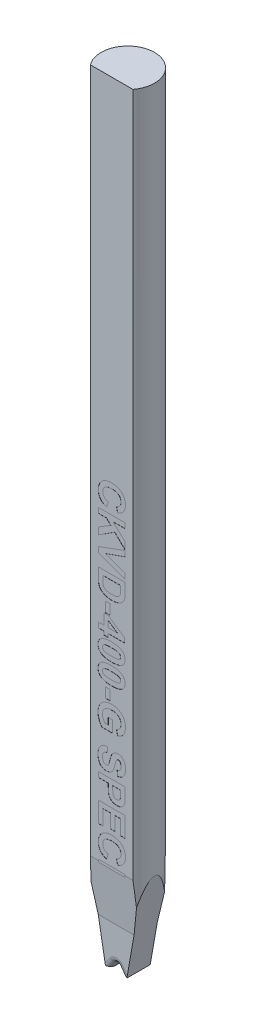
from build123d import *

# Parameters (mm, degrees)
SKETCH_TL_CUTTING_R       = 0.99695
TL_CUTTING_DEPTH          = 29.0068
SKETCH_TDF_GRINDING_W     = 2.0139
SKETCH_TDF_GRINDING_H     = 2.0139
TDF_GRINDING_DEPTH        = 30.041044486
SKETCH_ENGRAVING_W        = 0.166666667
SKETCH_ENGRAVING_H        = 0.371794872
SKETCH_ENGRAVING_W_2      = 1
SKETCH_ENGRAVING_H_2      = 0.192307693
ENGRAVING_DEPTH           = 0.005
VW_VR_GRINDING_DEPTH      = 1.00695
VW_VR_GRINDING_DEPTH_BACK = 1.00695
ISA_GRINDING_DEPTH        = 1.00695
ISA_GRINDING_DEPTH_BACK   = 1.00695
PRE_FRX_BRX_DEPTH         = 1.00695
PRE_FRX_BRX_DEPTH_BACK    = 1.00695
SKETCH_PRE_FRX_BRX_W      = 0.57134
SKETCH_PRE_FRX_BRX_H      = 1.524
FR_EDM_R                  = 0.20066
BR_EDM_R                  = 0.20066
FA_BA_GRINDING_DEPTH      = 1.00695
FA_BA_GRINDING_DEPTH_BACK = 1.00695


with BuildPart() as part:
    # sketch_TL_cutting → TL_cutting (new body)
    with BuildSketch(Plane(origin=(0, 0, 0), x_dir=(1, 0, 0), z_dir=(0, 1, 0))):
        Circle(SKETCH_TL_CUTTING_R)
    extrude(amount=TL_CUTTING_DEPTH)

    # sketch_TDF_grinding → TDF_grinding (cut, through all)
    with BuildSketch(Plane(origin=(0, 0, 0), x_dir=(1, 0, 0), z_dir=(0, 1, 0))):
        with Locations((0, -1.6102)):
            Rectangle(SKETCH_TDF_GRINDING_W, SKETCH_TDF_GRINDING_H)
    extrude(amount=TDF_GRINDING_DEPTH, mode=Mode.SUBTRACT)

    # sketch_engraving → engraving (cut)
    # profile 1 of 19: a face of its own
    with BuildSketch(Plane.XY.offset(0.60325)):
        with BuildLine():
            Line((-0.128205128, 15.210150256), (-0.192307692, 15.017842564))
            add(Edge.make_bspline(
                [(-0.192307692, 15.017842564), (-0.204917923, 15.021749052), (-0.229612721, 15.029399184), (-0.2649877, 15.043477804), (-0.297871332, 15.059472008), (-0.328259475, 15.077299875), (-0.356049464, 15.097035258), (-0.381471598, 15.118529244), (-0.404368127, 15.141993424), (-0.424673345, 15.167410624), (-0.442633936, 15.194503711), (-0.457816548, 15.223596053), (-0.470893242, 15.25425117), (-0.481488041, 15.286780557), (-0.489972889, 15.320968151), (-0.495577171, 15.356974413), (-0.499377062, 15.394630896), (-0.499789062, 15.420343283), (-0.5, 15.433507628)],
                knots=[0, 0, 0, 0, 1.126670901, 2.206376047, 3.246533763, 4.245677351, 5.210506282, 6.152793389, 7.083980095, 8.004497442, 8.926231833, 9.854395169, 10.801995143, 11.768203916, 12.771938831, 13.805609698, 14.87650608, 16, 16, 16, 16], degree=3))
            add(Edge.make_bspline(
                [(-0.5, 15.433507628), (-0.499663994, 15.449756309), (-0.499003061, 15.481717949), (-0.492350465, 15.528459052), (-0.481969511, 15.573000328), (-0.467601869, 15.615409613), (-0.448555271, 15.655388786), (-0.42571373, 15.693313108), (-0.398318662, 15.728749391), (-0.367249987, 15.761890716), (-0.332452821, 15.792019196), (-0.294134751, 15.818012297), (-0.253074131, 15.840550491), (-0.208709772, 15.858476594), (-0.161353037, 15.872561791), (-0.110975156, 15.882408328), (-0.057578507, 15.888574942), (-0.020984357, 15.889277083), (-0.002203526, 15.889637436)],
                knots=[0, 0, 0, 0, 1.025134988, 2.016471176, 2.973446247, 3.909197306, 4.836872559, 5.763618465, 6.698581235, 7.658772073, 8.627106982, 9.597494692, 10.576422683, 11.578339294, 12.6118974, 13.690673505, 14.814808564, 16, 16, 16, 16], degree=3))
            add(Edge.make_bspline(
                [(-0.002203526, 15.889637436), (0.017576475, 15.8892692), (0.056163648, 15.888550839), (0.112313555, 15.882502878), (0.165084042, 15.872456768), (0.214577853, 15.858880058), (0.260470573, 15.840669249), (0.303160692, 15.818813909), (0.342311169, 15.792696152), (0.377833814, 15.762771091), (0.409480853, 15.729637852), (0.437377469, 15.693933428), (0.460593243, 15.655431041), (0.479896446, 15.614607336), (0.494630503, 15.571163397), (0.505304611, 15.525216602), (0.511505561, 15.476746054), (0.512376199, 15.44360808), (0.512820513, 15.426696731)],
                knots=[0, 0, 0, 0, 1.212773307, 2.365899439, 3.458117515, 4.504331001, 5.50806732, 6.480562534, 7.440239902, 8.387651817, 9.323121479, 10.245404239, 11.160468186, 12.07454208, 13.009500751, 13.96802424, 14.963018902, 16, 16, 16, 16], degree=3))
            add(Edge.make_bspline(
                [(0.512820513, 15.426696731), (0.512448361, 15.411927276), (0.511718707, 15.382969796), (0.506761415, 15.340564506), (0.498061698, 15.300376158), (0.486319015, 15.262187521), (0.470821797, 15.226215987), (0.451884357, 15.192397111), (0.429606892, 15.160614651), (0.412205553, 15.141465065), (0.403445513, 15.131824936)],
                knots=[0, 0, 0, 0, 1.098510076, 2.153775193, 3.169777012, 4.153122333, 5.120892526, 6.076995459, 7.031936742, 8, 8, 8, 8], degree=3))
            add(Edge.make_bspline(
                [(0.403445513, 15.131824936), (0.39787141, 15.126237644), (0.386592274, 15.114931818), (0.367549896, 15.099835368), (0.347050772, 15.085522058), (0.324745215, 15.072219068), (0.30046466, 15.060346849), (0.274581981, 15.049334097), (0.246997406, 15.039195069), (0.227800247, 15.033556604), (0.217948718, 15.030663077)],
                knots=[0, 0, 0, 0, 0.885292881, 1.791380647, 2.722937556, 3.69093542, 4.703306561, 5.754477758, 6.847650944, 8, 8, 8, 8], degree=3))
            Line((0.217948718, 15.030663077), (0.179487179, 15.222970769))
            add(Edge.make_bspline(
                [(0.179487179, 15.222970769), (0.1857949, 15.224605288), (0.198219456, 15.227824861), (0.21607256, 15.23433955), (0.233014714, 15.241811208), (0.248625569, 15.2510761), (0.263619506, 15.260902074), (0.277222328, 15.272564773), (0.290109132, 15.285069754), (0.301694454, 15.298958861), (0.312145605, 15.313833589), (0.321339918, 15.329543983), (0.329014435, 15.346128478), (0.335156827, 15.363461754), (0.340319842, 15.381485702), (0.34350638, 15.400372147), (0.345953545, 15.419955752), (0.3460861, 15.433298875), (0.346153846, 15.440118205)],
                knots=[0, 0, 0, 0, 1.051114734, 2.070420253, 3.064047898, 4.034553068, 4.997066449, 5.953344811, 6.921213386, 7.892675544, 8.867420182, 9.852654213, 10.826683617, 11.811917648, 12.818610352, 13.848120519, 14.900229319, 16, 16, 16, 16], degree=3))
            add(Edge.make_bspline(
                [(0.346153846, 15.440118205), (0.345958725, 15.449482256), (0.345576529, 15.46782423), (0.341532101, 15.49455448), (0.335695112, 15.519995692), (0.326982094, 15.54405706), (0.315677399, 15.566671698), (0.302244603, 15.588168905), (0.286035184, 15.608000806), (0.26758257, 15.626639764), (0.246135655, 15.643347721), (0.221779967, 15.658050652), (0.194212535, 15.670244121), (0.163711493, 15.680144409), (0.130202077, 15.687936736), (0.093641969, 15.693501162), (0.054005962, 15.696578434), (0.026581025, 15.697073903), (0.012419872, 15.697329744)],
                knots=[0, 0, 0, 0, 0.93816214, 1.837638998, 2.704791736, 3.551915875, 4.396257554, 5.235807848, 6.087970119, 6.959042444, 7.860386085, 8.80649345, 9.804409709, 10.875695391, 12.017327537, 13.250155505, 14.580089023, 16, 16, 16, 16], degree=3))
            add(Edge.make_bspline(
                [(0.012419872, 15.697329744), (-0.002609028, 15.697076423), (-0.031567402, 15.696588312), (-0.073337178, 15.693511685), (-0.111754322, 15.687911705), (-0.14688701, 15.680222849), (-0.178713725, 15.670272973), (-0.207179389, 15.658099106), (-0.23231734, 15.643626701), (-0.254110839, 15.626878275), (-0.272831387, 15.608277256), (-0.288926796, 15.588327439), (-0.302688307, 15.567146524), (-0.314010391, 15.544607053), (-0.322575422, 15.520623298), (-0.328786932, 15.495392371), (-0.332735688, 15.468821695), (-0.333131326, 15.450615799), (-0.333333333, 15.441320128)],
                knots=[0, 0, 0, 0, 1.475208372, 2.842499301, 4.107722225, 5.282836115, 6.369007568, 7.375918121, 8.315702116, 9.208439171, 10.065831443, 10.90006451, 11.71996243, 12.54067204, 13.369972975, 14.214060185, 15.088124569, 16, 16, 16, 16], degree=3))
            add(Edge.make_bspline(
                [(-0.333333333, 15.441320128), (-0.333161634, 15.434437953), (-0.332824013, 15.420905176), (-0.330681155, 15.400902689), (-0.326591822, 15.38170438), (-0.321184418, 15.363216281), (-0.314399721, 15.345366559), (-0.305696319, 15.32842748), (-0.295693052, 15.312065777), (-0.283969989, 15.29662094), (-0.270808612, 15.281886156), (-0.255597341, 15.268447159), (-0.238701667, 15.255981373), (-0.220008678, 15.244646947), (-0.199678377, 15.23406516), (-0.177394008, 15.225062121), (-0.153515697, 15.216674984), (-0.136789345, 15.212363153), (-0.128205128, 15.210150256)],
                knots=[0, 0, 0, 0, 0.980177776, 1.927374078, 2.859849964, 3.771585772, 4.668674471, 5.574490016, 6.479656464, 7.396337719, 8.332153134, 9.288470092, 10.28125149, 11.318486971, 12.398724812, 13.541284404, 14.738150009, 16, 16, 16, 16], degree=3))
        make_face()
    # profile 2 of 19: a face of its own
    with BuildSketch(Plane.XY.offset(0.60325)):
        Polygon((-0.5, 14.851175897), (0.5, 14.851175897), (0.5, 14.658868205), (0.052283654, 14.658868205), (0.5, 14.237193526), (0.5, 13.972970769), (0.11338141, 14.352778462), (-0.5, 13.960150256), (-0.5, 14.216360192), (-0.035456731, 14.498611795), (-0.198517628, 14.658868205), (-0.5, 14.658868205), align=None)
    # profile 3 of 19: a face of its own
    with BuildSketch(Plane.XY.offset(0.60325)):
        Polygon((-0.5, 13.583948333), (0.5, 13.95374), (0.5, 13.750615), (-0.243589744, 13.485791282), (0.5, 13.221969167), (0.5, 13.017842564), (-0.5, 13.386231987), align=None)
    # profile 4 of 19: a face of its own
    with BuildSketch(Plane.XY.offset(0.60325)):
        with BuildLine():
            Line((0.5, 12.928098974), (0.5, 12.561312115))
            add(Edge.make_bspline(
                [(0.5, 12.561312115), (0.500005193, 12.551294571), (0.500015306, 12.531788084), (0.498840892, 12.503479066), (0.497659587, 12.477006494), (0.495294873, 12.452446352), (0.492816233, 12.429713432), (0.489678088, 12.408766942), (0.485656212, 12.389739202), (0.482484481, 12.377740319), (0.480969551, 12.372009231)],
                knots=[0, 0, 0, 0, 1.259756885, 2.453039283, 3.563158368, 4.591894114, 5.55549294, 6.43918076, 7.254497783, 8, 8, 8, 8], degree=3))
            add(Edge.make_bspline(
                [(0.480969551, 12.372009231), (0.478637325, 12.364840254), (0.474014881, 12.350631431), (0.465827813, 12.329778378), (0.455960096, 12.309944479), (0.445111978, 12.290669819), (0.432903728, 12.272397553), (0.419595761, 12.254682873), (0.404753223, 12.238049803), (0.383633179, 12.21651514), (0.35420815, 12.192090255), (0.315375005, 12.16625972), (0.272594656, 12.144522014), (0.234409605, 12.129330641), (0.20183843, 12.119286542), (0.175754603, 12.112718141), (0.148301213, 12.107046468), (0.119383738, 12.102796292), (0.08913491, 12.099134906), (0.057465542, 12.096507238), (0.024383276, 12.09520625), (0.001870575, 12.094914494), (-0.009615385, 12.094765641)],
                knots=[0, 0, 0, 0, 0.745431882, 1.477436776, 2.212739876, 2.934276521, 3.663147754, 4.384200836, 5.123377481, 5.865761747, 7.365547505, 8.894711587, 10.468722596, 12.101948761, 12.951987285, 13.837595333, 14.760899389, 15.722756883, 16.726861385, 17.773652936, 18.864119771, 20, 20, 20, 20], degree=3))
            add(Edge.make_bspline(
                [(-0.009615385, 12.094765641), (-0.0294616, 12.095157046), (-0.067834928, 12.09591384), (-0.123301552, 12.101511211), (-0.17465514, 12.110806648), (-0.206804138, 12.120517075), (-0.222355769, 12.125214359)],
                knots=[0, 0, 0, 0, 1.103491527, 2.133638164, 3.0971734, 4, 4, 4, 4], degree=3))
            add(Edge.make_bspline(
                [(-0.222355769, 12.125214359), (-0.231274521, 12.128388003), (-0.248819098, 12.134631057), (-0.274127236, 12.145555932), (-0.298211673, 12.157360337), (-0.321053432, 12.170142184), (-0.342549771, 12.183966052), (-0.362636394, 12.198883645), (-0.381577746, 12.214663731), (-0.393236239, 12.22609549), (-0.399038462, 12.231784872)],
                knots=[0, 0, 0, 0, 1.090884612, 2.145940218, 3.175104604, 4.181306866, 5.161203701, 6.118658341, 7.063689906, 8, 8, 8, 8], degree=3))
            add(Edge.make_bspline(
                [(-0.399038462, 12.231784872), (-0.407300305, 12.241071145), (-0.424264154, 12.260138431), (-0.445652736, 12.29348995), (-0.464086504, 12.331365276), (-0.473760833, 12.358679168), (-0.478766026, 12.372810513)],
                knots=[0, 0, 0, 0, 0.912008655, 1.872605891, 2.89935344, 4, 4, 4, 4], degree=3))
            add(Edge.make_bspline(
                [(-0.478766026, 12.372810513), (-0.4805228, 12.378530486), (-0.484168894, 12.390401996), (-0.488062998, 12.409225444), (-0.492165475, 12.429319947), (-0.49463687, 12.450917223), (-0.497243066, 12.473793081), (-0.498706299, 12.498129822), (-0.49974511, 12.523843081), (-0.499913777, 12.541479175), (-0.5, 12.550494808)],
                knots=[0, 0, 0, 0, 0.799129865, 1.658552685, 2.566799617, 3.538529252, 4.561352959, 5.643373779, 6.795284424, 8, 8, 8, 8], degree=3))
            Line((-0.5, 12.550494808), (-0.5, 12.928098974))
            Line((-0.5, 12.928098974), (0.5, 12.928098974))
        make_face()
        with BuildLine():
            Line((0.333333333, 12.735791282), (-0.333333333, 12.735791282))
            Line((-0.333333333, 12.735791282), (-0.333333333, 12.577538077))
            add(Edge.make_bspline(
                [(-0.333333333, 12.577538077), (-0.333276671, 12.57039336), (-0.333167574, 12.556637049), (-0.332847006, 12.536731316), (-0.331979167, 12.518438115), (-0.331080228, 12.501661614), (-0.329595022, 12.48644549), (-0.328134266, 12.472723535), (-0.326090699, 12.460572132), (-0.324477534, 12.453067127), (-0.323717949, 12.449533269)],
                knots=[0, 0, 0, 0, 1.333384787, 2.567275092, 3.714769766, 4.750907381, 5.701951617, 6.567520054, 7.325492842, 8, 8, 8, 8], degree=3))
            add(Edge.make_bspline(
                [(-0.323717949, 12.449533269), (-0.321509316, 12.441256575), (-0.317207482, 12.425135757), (-0.307617456, 12.402500499), (-0.296048139, 12.382018507), (-0.282136533, 12.36334677), (-0.26455548, 12.34651967), (-0.242070693, 12.332155683), (-0.215254411, 12.318862192), (-0.189584523, 12.309758806), (-0.16665678, 12.303224413), (-0.147412959, 12.298801165), (-0.126593091, 12.295305591), (-0.104279343, 12.292298942), (-0.080500412, 12.289869499), (-0.055170426, 12.288357784), (-0.028320392, 12.287326029), (-0.009883527, 12.287159161), (-0.000400641, 12.287073333)],
                knots=[0, 0, 0, 0, 1.038686998, 2.023088296, 2.974059649, 3.888265163, 4.839857954, 5.909819677, 7.113156087, 8.466843969, 9.20827164, 10.006482943, 10.861893492, 11.769681931, 12.739021491, 13.762258324, 14.849031541, 16, 16, 16, 16], degree=3))
            add(Edge.make_bspline(
                [(-0.000400641, 12.287073333), (0.009082275, 12.2871585), (0.027452469, 12.287323485), (0.054102292, 12.288353664), (0.079033415, 12.289856863), (0.102276578, 12.292303691), (0.123864169, 12.295263456), (0.143813574, 12.298800891), (0.161996804, 12.303194423), (0.183589283, 12.309747511), (0.207947697, 12.319584996), (0.23429421, 12.333411199), (0.2571147, 12.349676402), (0.276689574, 12.368031558), (0.29287817, 12.389118569), (0.306422028, 12.412489371), (0.316938162, 12.438620279), (0.321416742, 12.457209318), (0.323717949, 12.466760833)],
                knots=[0, 0, 0, 0, 1.118059345, 2.165891593, 3.144157881, 4.062285166, 4.920717571, 5.712910489, 6.449981617, 7.12489426, 8.371943983, 9.541298068, 10.624898781, 11.666293176, 12.69306237, 13.747704633, 14.842713931, 16, 16, 16, 16], degree=3))
            add(Edge.make_bspline(
                [(0.323717949, 12.466760833), (0.324486218, 12.470895143), (0.326177652, 12.479997311), (0.328151987, 12.495101571), (0.329628909, 12.512888179), (0.331099472, 12.533317116), (0.331977905, 12.556367064), (0.332859431, 12.582072571), (0.333166326, 12.610456851), (0.333276065, 12.630289207), (0.333333333, 12.640639038)],
                knots=[0, 0, 0, 0, 0.578739524, 1.274162912, 2.095457587, 3.035141998, 4.093102578, 5.270121571, 6.575369351, 8, 8, 8, 8], degree=3))
            Line((0.333333333, 12.640639038), (0.333333333, 12.735791282))
        make_face(mode=Mode.SUBTRACT)
    # profile 5 of 19: a face of its own
    with BuildSketch(Plane.XY.offset(0.60325)):
        with Locations((-0.147435898, 11.767842564)):
            Rectangle(SKETCH_ENGRAVING_W, SKETCH_ENGRAVING_H)
    # profile 6 of 19: a face of its own
    with BuildSketch(Plane.XY.offset(0.60325)):
        Polygon((-0.5, 11.146047692), (-0.294871795, 11.146047692), (-0.294871795, 11.54348359), (-0.12880609, 11.54348359), (0.487179487, 11.120606987), (0.487179487, 10.95374), (-0.128205128, 10.95374), (-0.128205128, 10.825534872), (-0.294871795, 10.825534872), (-0.294871795, 10.95374), (-0.5, 10.95374), align=None)
        Polygon((-0.128205128, 11.146047692), (0.204727564, 11.146047692), (-0.128205128, 11.374813718), align=None, mode=Mode.SUBTRACT)
    # profile 7 of 19: a face of its own
    with BuildSketch(Plane.XY.offset(0.60325)):
        with BuildLine():
            add(Edge.make_bspline(
                [(0.5, 10.421688718), (0.49971384, 10.409784998), (0.499156721, 10.386609821), (0.494192381, 10.352847508), (0.486315205, 10.321094925), (0.474936732, 10.291345943), (0.460535804, 10.263449267), (0.442472771, 10.237797415), (0.421624591, 10.21379643), (0.405435577, 10.199940797), (0.397235577, 10.192922692)],
                knots=[0, 0, 0, 0, 1.098626248, 2.138899374, 3.143835643, 4.113754749, 5.073488057, 6.034745239, 7.004566348, 8, 8, 8, 8], degree=3))
            add(Edge.make_bspline(
                [(0.397235577, 10.192922692), (0.392013767, 10.188907993), (0.381356969, 10.180714695), (0.364136726, 10.16968029), (0.345869985, 10.159071685), (0.326116385, 10.149813442), (0.305221356, 10.140940078), (0.283126793, 10.132749313), (0.259707844, 10.12551695), (0.235071142, 10.119212124), (0.209179241, 10.113318627), (0.181968999, 10.108381398), (0.15350924, 10.104155972), (0.123831018, 10.100860738), (0.092992495, 10.097906339), (0.060842825, 10.096289757), (0.027454838, 10.094965267), (0.004742429, 10.094832949), (-0.006810897, 10.094765641)],
                knots=[0, 0, 0, 0, 0.746775751, 1.524038446, 2.317840886, 3.141016509, 3.996283186, 4.892488336, 5.812382473, 6.774967264, 7.776368117, 8.823659909, 9.910833035, 11.039122168, 12.210293276, 13.424012874, 14.68964937, 16, 16, 16, 16], degree=3))
            add(Edge.make_bspline(
                [(-0.006810897, 10.094765641), (-0.01836425, 10.094831934), (-0.041009977, 10.094961876), (-0.074330982, 10.096294693), (-0.106413621, 10.097907781), (-0.13725379, 10.100853853), (-0.166926114, 10.104180728), (-0.195353975, 10.108286272), (-0.22243919, 10.113604764), (-0.248289812, 10.119411418), (-0.27303117, 10.125676077), (-0.296407841, 10.1332299), (-0.318777777, 10.141090303), (-0.339699687, 10.150169898), (-0.359477735, 10.159760372), (-0.377930928, 10.170211112), (-0.395257891, 10.181368726), (-0.40597091, 10.189641289), (-0.411258013, 10.193723974)],
                knots=[0, 0, 0, 0, 1.308411734, 2.564617834, 3.776541518, 4.94597967, 6.0725993, 7.15816376, 8.197872509, 9.197791611, 10.158952087, 11.086962723, 11.979249638, 12.843171697, 13.668427753, 14.467630577, 15.243743175, 16, 16, 16, 16], degree=3))
            add(Edge.make_bspline(
                [(-0.411258013, 10.193723974), (-0.419387722, 10.200677875), (-0.435436162, 10.214405209), (-0.456111536, 10.238140465), (-0.473801555, 10.2637509), (-0.487914093, 10.291597064), (-0.499368982, 10.321201236), (-0.506993451, 10.353005546), (-0.511967929, 10.386675616), (-0.512532265, 10.409851213), (-0.512820513, 10.421688718)],
                knots=[0, 0, 0, 0, 0.991667276, 1.957599061, 2.911530233, 3.873218945, 4.847995157, 5.850445929, 6.902062539, 8, 8, 8, 8], degree=3))
            add(Edge.make_bspline(
                [(-0.512820513, 10.421688718), (-0.512476011, 10.433661133), (-0.511800941, 10.457121702), (-0.506449472, 10.491375149), (-0.497876451, 10.523934622), (-0.485636462, 10.554683234), (-0.469774335, 10.583576989), (-0.45076002, 10.610841616), (-0.427732542, 10.635883948), (-0.40629523, 10.655489361), (-0.386925042, 10.669832741), (-0.37086259, 10.679949036), (-0.353675124, 10.689725358), (-0.33482528, 10.698163499), (-0.314870578, 10.706488475), (-0.293380967, 10.713861787), (-0.270541238, 10.720366959), (-0.246455682, 10.726474901), (-0.220958398, 10.731568025), (-0.194124629, 10.736252952), (-0.165840258, 10.739944927), (-0.136262825, 10.743218243), (-0.105322509, 10.745522844), (-0.073069943, 10.747394475), (-0.039401887, 10.748332969), (-0.01649349, 10.748517608), (-0.004807692, 10.748611795)],
                knots=[0, 0, 0, 0, 1.257818097, 2.464759732, 3.634271214, 4.790227596, 5.933394726, 7.09190477, 8.274482889, 9.50191983, 10.139172818, 10.805000628, 11.49619854, 12.215266328, 12.973768034, 13.768328009, 14.601232062, 15.469317089, 16.379095881, 17.333267023, 18.331755967, 19.376479622, 20.460535752, 21.592206075, 22.771760786, 24, 24, 24, 24], degree=3))
            add(Edge.make_bspline(
                [(-0.004807692, 10.748611795), (0.006678925, 10.748546), (0.02919122, 10.748417052), (0.062378132, 10.747074948), (0.094328674, 10.745481634), (0.12509981, 10.74250902), (0.154640959, 10.739209515), (0.183004063, 10.735096894), (0.209982531, 10.729678814), (0.235876189, 10.724329743), (0.260431507, 10.717589782), (0.2837906, 10.710164475), (0.306110518, 10.702330136), (0.326924245, 10.693157854), (0.346659803, 10.683622898), (0.365109758, 10.673164838), (0.382437536, 10.662009066), (0.39315045, 10.653736265), (0.3984375, 10.649653462)],
                knots=[0, 0, 0, 0, 1.304443357, 2.556541329, 3.771813033, 4.936929721, 6.066661712, 7.147723817, 8.190304831, 9.191350322, 10.149780912, 11.080355239, 11.975107155, 12.834450748, 13.66198663, 14.463397305, 15.241653965, 16, 16, 16, 16], degree=3))
            add(Edge.make_bspline(
                [(0.3984375, 10.649653462), (0.406566428, 10.642699179), (0.422613323, 10.628971089), (0.443299998, 10.605241361), (0.460913987, 10.579659209), (0.475197493, 10.551894301), (0.486497465, 10.522222107), (0.494183265, 10.490376121), (0.499144648, 10.456700686), (0.499710816, 10.433525839), (0.5, 10.421688718)],
                knots=[0, 0, 0, 0, 0.991631672, 1.957528776, 2.911425699, 3.867574088, 4.848108326, 5.850523106, 6.902101959, 8, 8, 8, 8], degree=3))
        make_face()
        with BuildLine():
            add(Edge.make_bspline(
                [(0.333333333, 10.421688718), (0.333068079, 10.427856684), (0.332548986, 10.439927158), (0.328316127, 10.457482094), (0.321759633, 10.474063165), (0.312130705, 10.489621206), (0.299093083, 10.50402978), (0.281476094, 10.516237658), (0.259881539, 10.526791162), (0.243736, 10.532070771), (0.235176282, 10.534869808)],
                knots=[0, 0, 0, 0, 0.909107913, 1.77908945, 2.650019014, 3.530482969, 4.465025013, 5.495890128, 6.672421267, 8, 8, 8, 8], degree=3))
            add(Edge.make_bspline(
                [(0.235176282, 10.534869808), (0.228718042, 10.536617997), (0.214837576, 10.540375317), (0.192206647, 10.54463972), (0.166522939, 10.548156485), (0.137792419, 10.551126038), (0.105999886, 10.553542628), (0.071125109, 10.555030848), (0.033192525, 10.556059478), (0.006878451, 10.556220391), (-0.006810897, 10.556304103)],
                knots=[0, 0, 0, 0, 0.658986521, 1.416336438, 2.266694271, 3.212608458, 4.261595115, 5.407496572, 6.651304179, 8, 8, 8, 8], degree=3))
            add(Edge.make_bspline(
                [(-0.006810897, 10.556304103), (-0.020433943, 10.556313117), (-0.046549094, 10.556330397), (-0.084006477, 10.555156163), (-0.118154033, 10.55398872), (-0.148991056, 10.551619061), (-0.176626244, 10.549280892), (-0.200847568, 10.545743343), (-0.221857789, 10.542190608), (-0.244486895, 10.536157153), (-0.268257705, 10.527841394), (-0.292448985, 10.516612977), (-0.311537375, 10.503947058), (-0.325415776, 10.489415587), (-0.334597404, 10.473670329), (-0.341538269, 10.457366395), (-0.345246665, 10.439814555), (-0.345848983, 10.427780013), (-0.346153846, 10.421688718)],
                knots=[0, 0, 0, 0, 1.613038927, 3.092168624, 4.43749063, 5.658264602, 6.75425577, 7.720394221, 8.556328411, 9.275513998, 10.490872946, 11.534172084, 12.42681833, 13.187531851, 13.88996177, 14.574222125, 15.278341114, 16, 16, 16, 16], degree=3))
            add(Edge.make_bspline(
                [(-0.346153846, 10.421688718), (-0.345874419, 10.41559088), (-0.345321688, 10.403528799), (-0.341225408, 10.385996833), (-0.334465655, 10.369439336), (-0.325029126, 10.353776493), (-0.311901617, 10.33935441), (-0.294300445, 10.327137614), (-0.272700888, 10.31658693), (-0.25655611, 10.311306893), (-0.247996795, 10.308507628)],
                knots=[0, 0, 0, 0, 0.899391665, 1.779078861, 2.640979247, 3.529945348, 4.464599804, 5.495588918, 6.672261578, 8, 8, 8, 8], degree=3))
            add(Edge.make_bspline(
                [(-0.247996795, 10.308507628), (-0.241538043, 10.306761968), (-0.227719754, 10.303027186), (-0.205229709, 10.298732396), (-0.179679092, 10.29520611), (-0.151079269, 10.292264791), (-0.11935541, 10.289824431), (-0.084546407, 10.288348845), (-0.046680798, 10.287319247), (-0.020433482, 10.287157356), (-0.006810897, 10.287073333)],
                knots=[0, 0, 0, 0, 0.66114423, 1.414496391, 2.261103113, 3.210114492, 4.255954433, 5.405607896, 6.653488082, 8, 8, 8, 8], degree=3))
            add(Edge.make_bspline(
                [(-0.006810897, 10.287073333), (0.006810741, 10.287187109), (0.032921137, 10.287405199), (0.070464093, 10.288032091), (0.104645163, 10.289787006), (0.13553417, 10.291543226), (0.163028833, 10.294508631), (0.187277888, 10.297451537), (0.208178651, 10.301523667), (0.23096624, 10.307115697), (0.254848985, 10.31545368), (0.278913284, 10.32702584), (0.298191428, 10.33946291), (0.312146257, 10.353969879), (0.321683592, 10.369688044), (0.328364426, 10.386140374), (0.332523972, 10.403589531), (0.333060584, 10.41558941), (0.333333333, 10.421688718)],
                knots=[0, 0, 0, 0, 1.611458614, 3.088895909, 4.441089836, 5.660086535, 6.747875232, 7.711965119, 8.548505902, 9.26500436, 10.486583113, 11.532259092, 12.419544583, 13.184925779, 13.890764661, 14.581638641, 15.279074115, 16, 16, 16, 16], degree=3))
        make_face(mode=Mode.SUBTRACT)
    # profile 8 of 19: a face of its own
    with BuildSketch(Plane.XY.offset(0.60325)):
        with BuildLine():
            add(Edge.make_bspline(
                [(0.5, 9.652457949), (0.49971384, 9.640554229), (0.499156721, 9.617379051), (0.494192381, 9.583616739), (0.486315205, 9.551864156), (0.474936732, 9.522115173), (0.460535804, 9.494218497), (0.442472771, 9.468566646), (0.421624591, 9.444565661), (0.405435577, 9.430710028), (0.397235577, 9.423691923)],
                knots=[0, 0, 0, 0, 1.098626248, 2.138899374, 3.143835643, 4.113754749, 5.073488057, 6.034745239, 7.004566348, 8, 8, 8, 8], degree=3))
            add(Edge.make_bspline(
                [(0.397235577, 9.423691923), (0.392013767, 9.419677224), (0.381356969, 9.411483926), (0.364136726, 9.40044952), (0.345869985, 9.389840915), (0.326116385, 9.380582673), (0.305221356, 9.371709309), (0.283126793, 9.363518544), (0.259707844, 9.35628618), (0.235071142, 9.349981354), (0.209179241, 9.344087858), (0.181968999, 9.339150628), (0.15350924, 9.334925203), (0.123831018, 9.331629969), (0.092992495, 9.32867557), (0.060842825, 9.327058988), (0.027454838, 9.325734498), (0.004742429, 9.325602179), (-0.006810897, 9.325534872)],
                knots=[0, 0, 0, 0, 0.746775751, 1.524038446, 2.317840886, 3.141016509, 3.996283186, 4.892488336, 5.812382473, 6.774967264, 7.776368117, 8.823659909, 9.910833035, 11.039122168, 12.210293276, 13.424012874, 14.68964937, 16, 16, 16, 16], degree=3))
            add(Edge.make_bspline(
                [(-0.006810897, 9.325534872), (-0.01836425, 9.325601165), (-0.041009977, 9.325731107), (-0.074330982, 9.327063924), (-0.106413621, 9.328677012), (-0.13725379, 9.331623084), (-0.166926114, 9.334949959), (-0.195353975, 9.339055503), (-0.22243919, 9.344373995), (-0.248289812, 9.350180649), (-0.27303117, 9.356445308), (-0.296407841, 9.363999131), (-0.318777777, 9.371859533), (-0.339699687, 9.380939129), (-0.359477735, 9.390529602), (-0.377930928, 9.400980342), (-0.395257891, 9.412137957), (-0.40597091, 9.42041052), (-0.411258013, 9.424493205)],
                knots=[0, 0, 0, 0, 1.308411734, 2.564617834, 3.776541518, 4.94597967, 6.0725993, 7.15816376, 8.197872509, 9.197791611, 10.158952087, 11.086962723, 11.979249638, 12.843171697, 13.668427753, 14.467630577, 15.243743175, 16, 16, 16, 16], degree=3))
            add(Edge.make_bspline(
                [(-0.411258013, 9.424493205), (-0.419387722, 9.431447105), (-0.435436162, 9.44517444), (-0.456111536, 9.468909695), (-0.473801555, 9.494520131), (-0.487914093, 9.522366295), (-0.499368982, 9.551970467), (-0.506993451, 9.583774777), (-0.511967929, 9.617444847), (-0.512532265, 9.640620444), (-0.512820513, 9.652457949)],
                knots=[0, 0, 0, 0, 0.991667276, 1.957599061, 2.911530233, 3.873218945, 4.847995157, 5.850445929, 6.902062539, 8, 8, 8, 8], degree=3))
            add(Edge.make_bspline(
                [(-0.512820513, 9.652457949), (-0.512476011, 9.664430364), (-0.511800941, 9.687890933), (-0.506449472, 9.722144379), (-0.497876451, 9.754703853), (-0.485636462, 9.785452465), (-0.469774335, 9.81434622), (-0.45076002, 9.841610847), (-0.427732542, 9.866653179), (-0.40629523, 9.886258592), (-0.386925042, 9.900601971), (-0.37086259, 9.910718267), (-0.353675124, 9.920494589), (-0.33482528, 9.92893273), (-0.314870578, 9.937257706), (-0.293380967, 9.944631018), (-0.270541238, 9.95113619), (-0.246455682, 9.957244132), (-0.220958398, 9.962337256), (-0.194124629, 9.967022183), (-0.165840258, 9.970714157), (-0.136262825, 9.973987473), (-0.105322509, 9.976292075), (-0.073069943, 9.978163706), (-0.039401887, 9.9791022), (-0.01649349, 9.979286839), (-0.004807692, 9.979381026)],
                knots=[0, 0, 0, 0, 1.257818097, 2.464759732, 3.634271214, 4.790227596, 5.933394726, 7.09190477, 8.274482889, 9.50191983, 10.139172818, 10.805000628, 11.49619854, 12.215266328, 12.973768034, 13.768328009, 14.601232062, 15.469317089, 16.379095881, 17.333267023, 18.331755967, 19.376479622, 20.460535752, 21.592206075, 22.771760786, 24, 24, 24, 24], degree=3))
            add(Edge.make_bspline(
                [(-0.004807692, 9.979381026), (0.006678925, 9.979315231), (0.02919122, 9.979186282), (0.062378132, 9.977844179), (0.094328674, 9.976250865), (0.12509981, 9.973278251), (0.154640959, 9.969978746), (0.183004063, 9.965866125), (0.209982531, 9.960448045), (0.235876189, 9.955098974), (0.260431507, 9.948359013), (0.2837906, 9.940933706), (0.306110518, 9.933099367), (0.326924245, 9.923927084), (0.346659803, 9.914392128), (0.365109758, 9.903934069), (0.382437536, 9.892778297), (0.39315045, 9.884505495), (0.3984375, 9.880422692)],
                knots=[0, 0, 0, 0, 1.304443357, 2.556541329, 3.771813033, 4.936929721, 6.066661712, 7.147723817, 8.190304831, 9.191350322, 10.149780912, 11.080355239, 11.975107155, 12.834450748, 13.66198663, 14.463397305, 15.241653965, 16, 16, 16, 16], degree=3))
            add(Edge.make_bspline(
                [(0.3984375, 9.880422692), (0.406566428, 9.87346841), (0.422613323, 9.85974032), (0.443299998, 9.836010592), (0.460913987, 9.810428439), (0.475197493, 9.782663532), (0.486497465, 9.752991338), (0.494183265, 9.721145352), (0.499144648, 9.687469916), (0.499710816, 9.66429507), (0.5, 9.652457949)],
                knots=[0, 0, 0, 0, 0.991631672, 1.957528776, 2.911425699, 3.867574088, 4.848108326, 5.850523106, 6.902101959, 8, 8, 8, 8], degree=3))
        make_face()
        with BuildLine():
            add(Edge.make_bspline(
                [(0.333333333, 9.652457949), (0.333068079, 9.658625915), (0.332548986, 9.670696389), (0.328316127, 9.688251325), (0.321759633, 9.704832396), (0.312130705, 9.720390436), (0.299093083, 9.734799011), (0.281476094, 9.747006888), (0.259881539, 9.757560392), (0.243736, 9.762840001), (0.235176282, 9.765639038)],
                knots=[0, 0, 0, 0, 0.909107913, 1.77908945, 2.650019014, 3.530482969, 4.465025013, 5.495890128, 6.672421267, 8, 8, 8, 8], degree=3))
            add(Edge.make_bspline(
                [(0.235176282, 9.765639038), (0.228718042, 9.767387227), (0.214837576, 9.771144548), (0.192206647, 9.775408951), (0.166522939, 9.778925716), (0.137792419, 9.781895269), (0.105999886, 9.784311859), (0.071125109, 9.785800078), (0.033192525, 9.786828709), (0.006878451, 9.786989622), (-0.006810897, 9.787073333)],
                knots=[0, 0, 0, 0, 0.658986521, 1.416336438, 2.266694271, 3.212608458, 4.261595115, 5.407496572, 6.651304179, 8, 8, 8, 8], degree=3))
            add(Edge.make_bspline(
                [(-0.006810897, 9.787073333), (-0.020433943, 9.787082347), (-0.046549094, 9.787099627), (-0.084006477, 9.785925394), (-0.118154033, 9.784757951), (-0.148991056, 9.782388292), (-0.176626244, 9.780050123), (-0.200847568, 9.776512574), (-0.221857789, 9.772959839), (-0.244486895, 9.766926384), (-0.268257705, 9.758610625), (-0.292448985, 9.747382207), (-0.311537375, 9.734716289), (-0.325415776, 9.720184818), (-0.334597404, 9.70443956), (-0.341538269, 9.688135625), (-0.345246665, 9.670583786), (-0.345848983, 9.658549244), (-0.346153846, 9.652457949)],
                knots=[0, 0, 0, 0, 1.613038927, 3.092168624, 4.43749063, 5.658264602, 6.75425577, 7.720394221, 8.556328411, 9.275513998, 10.490872946, 11.534172084, 12.42681833, 13.187531851, 13.88996177, 14.574222125, 15.278341114, 16, 16, 16, 16], degree=3))
            add(Edge.make_bspline(
                [(-0.346153846, 9.652457949), (-0.345874419, 9.646360111), (-0.345321688, 9.63429803), (-0.341225408, 9.616766063), (-0.334465655, 9.600208567), (-0.325029126, 9.584545723), (-0.311901617, 9.570123641), (-0.294300445, 9.557906845), (-0.272700888, 9.547356161), (-0.25655611, 9.542076123), (-0.247996795, 9.539276859)],
                knots=[0, 0, 0, 0, 0.899391665, 1.779078861, 2.640979247, 3.529945348, 4.464599804, 5.495588918, 6.672261578, 8, 8, 8, 8], degree=3))
            add(Edge.make_bspline(
                [(-0.247996795, 9.539276859), (-0.241538043, 9.537531199), (-0.227719754, 9.533796417), (-0.205229709, 9.529501627), (-0.179679092, 9.52597534), (-0.151079269, 9.523034022), (-0.11935541, 9.520593662), (-0.084546407, 9.519118076), (-0.046680798, 9.518088478), (-0.020433482, 9.517926587), (-0.006810897, 9.517842564)],
                knots=[0, 0, 0, 0, 0.66114423, 1.414496391, 2.261103113, 3.210114492, 4.255954433, 5.405607896, 6.653488082, 8, 8, 8, 8], degree=3))
            add(Edge.make_bspline(
                [(-0.006810897, 9.517842564), (0.006810741, 9.51795634), (0.032921137, 9.51817443), (0.070464093, 9.518801322), (0.104645163, 9.520556237), (0.13553417, 9.522312457), (0.163028833, 9.525277861), (0.187277888, 9.528220768), (0.208178651, 9.532292897), (0.23096624, 9.537884928), (0.254848985, 9.54622291), (0.278913284, 9.557795071), (0.298191428, 9.570232141), (0.312146257, 9.58473911), (0.321683592, 9.600457274), (0.328364426, 9.616909605), (0.332523972, 9.634358762), (0.333060584, 9.646358641), (0.333333333, 9.652457949)],
                knots=[0, 0, 0, 0, 1.611458614, 3.088895909, 4.441089836, 5.660086535, 6.747875232, 7.711965119, 8.548505902, 9.26500436, 10.486583113, 11.532259092, 12.419544583, 13.184925779, 13.890764661, 14.581638641, 15.279074115, 16, 16, 16, 16], degree=3))
        make_face(mode=Mode.SUBTRACT)
    # profile 9 of 19: a face of its own
    with BuildSketch(Plane.XY.offset(0.60325)):
        with Locations((-0.147435898, 8.998611795)):
            Rectangle(SKETCH_ENGRAVING_W, SKETCH_ENGRAVING_H)
    # profile 10 of 19: a face of its own
    with BuildSketch(Plane.XY.offset(0.60325)):
        with BuildLine():
            Line((-0.128205128, 8.248611795), (0.038461538, 8.248611795))
            Line((0.038461538, 8.248611795), (0.038461538, 7.812714359))
            Line((0.038461538, 7.812714359), (-0.36338141, 7.812714359))
            add(Edge.make_bspline(
                [(-0.36338141, 7.812714359), (-0.368321434, 7.818200375), (-0.378419843, 7.8294149), (-0.392661125, 7.847712664), (-0.406257259, 7.867856779), (-0.4194836, 7.889725469), (-0.432233696, 7.913363992), (-0.444685123, 7.938678064), (-0.45671611, 7.965714391), (-0.471787381, 8.003947711), (-0.488186169, 8.05316183), (-0.502445448, 8.113327076), (-0.511191227, 8.173968267), (-0.512277771, 8.214529075), (-0.512820513, 8.234789679)],
                knots=[0, 0, 0, 0, 0.581799769, 1.189316438, 1.825828404, 2.496525428, 3.203088405, 3.942228803, 4.719818701, 5.534979611, 7.181138583, 8.803804008, 10.403462225, 12, 12, 12, 12], degree=3))
            add(Edge.make_bspline(
                [(-0.512820513, 8.234789679), (-0.512629241, 8.247482166), (-0.512252188, 8.272502831), (-0.509233571, 8.309441118), (-0.504017902, 8.345158224), (-0.496780719, 8.379590736), (-0.487836372, 8.412841646), (-0.476607913, 8.444794166), (-0.463065488, 8.475414068), (-0.447986133, 8.504930581), (-0.430657849, 8.532783177), (-0.411724289, 8.559027023), (-0.390891397, 8.583407404), (-0.36853351, 8.606136217), (-0.344060025, 8.626784803), (-0.318106216, 8.645866641), (-0.290219674, 8.662925038), (-0.260879177, 8.678251559), (-0.230317098, 8.691880942), (-0.198781008, 8.703383246), (-0.166726875, 8.713466922), (-0.134042675, 8.721754707), (-0.10062201, 8.727841654), (-0.066619552, 8.732573529), (-0.031822841, 8.735115004), (-0.008417054, 8.735564325), (0.003405449, 8.735791282)],
                knots=[0, 0, 0, 0, 1.124897971, 2.217508473, 3.282174662, 4.322209414, 5.334422951, 6.332119154, 7.320662553, 8.300074908, 9.267468154, 10.225199689, 11.165658754, 12.107290334, 13.047749399, 14.00069605, 14.959944213, 15.942088746, 16.933021067, 17.923599838, 18.915715637, 19.910475908, 20.909926025, 21.925232038, 22.952013513, 24, 24, 24, 24], degree=3))
            add(Edge.make_bspline(
                [(0.003405449, 8.735791282), (0.016165747, 8.735607383), (0.041321811, 8.735244838), (0.078501182, 8.732115194), (0.114594914, 8.727267239), (0.149519517, 8.719872247), (0.183523729, 8.711018796), (0.216299841, 8.699674109), (0.248180515, 8.686720661), (0.278688999, 8.671436543), (0.308028284, 8.654553971), (0.335510174, 8.6353704), (0.361403632, 8.6145508), (0.385591047, 8.591907968), (0.407627145, 8.567069007), (0.428063784, 8.540543308), (0.447146094, 8.51234846), (0.457908016, 8.492171736), (0.463341346, 8.481985192)],
                knots=[0, 0, 0, 0, 1.105132952, 2.178694671, 3.229818344, 4.257558797, 5.269123684, 6.27148554, 7.259679084, 8.247804916, 9.224967877, 10.189258471, 11.147685264, 12.101072275, 13.055511435, 14.02039165, 15.000562851, 16, 16, 16, 16], degree=3))
            add(Edge.make_bspline(
                [(0.463341346, 8.481985192), (0.467347168, 8.473897841), (0.475455657, 8.457527618), (0.485329628, 8.431454525), (0.494054347, 8.404086948), (0.500719187, 8.375105473), (0.506115234, 8.344818993), (0.510216979, 8.313077917), (0.512307439, 8.279823708), (0.512647258, 8.257161284), (0.512820513, 8.245606987)],
                knots=[0, 0, 0, 0, 0.887950456, 1.797368171, 2.741221183, 3.713797788, 4.722103116, 5.768966405, 6.862521341, 8, 8, 8, 8], degree=3))
            add(Edge.make_bspline(
                [(0.512820513, 8.245606987), (0.512598613, 8.230709487), (0.512167059, 8.201736604), (0.508571106, 8.15949631), (0.502373597, 8.119742674), (0.493837942, 8.082420334), (0.482863355, 8.047609697), (0.469371425, 8.015370687), (0.453633675, 7.985505429), (0.435019378, 7.958446485), (0.414494937, 7.933643918), (0.392035387, 7.911162449), (0.367607461, 7.890993031), (0.341334074, 7.873122318), (0.313106625, 7.857690967), (0.283182558, 7.844422952), (0.251334696, 7.833501769), (0.22921692, 7.828223803), (0.217948718, 7.825534872)],
                knots=[0, 0, 0, 0, 1.271135529, 2.472123572, 3.614091059, 4.701890498, 5.736279567, 6.724681829, 7.680621489, 8.611506429, 9.52200816, 10.424540711, 11.318996785, 12.221421405, 13.131851814, 14.060431888, 15.011860567, 16, 16, 16, 16], degree=3))
            Line((0.217948718, 7.825534872), (0.179487179, 8.017842564))
            add(Edge.make_bspline(
                [(0.179487179, 8.017842564), (0.185798707, 8.019745146), (0.198251232, 8.023498905), (0.216108293, 8.030805481), (0.232994438, 8.039123603), (0.248643132, 8.048950597), (0.263649233, 8.059388251), (0.277161531, 8.071658435), (0.290187329, 8.084565453), (0.301701762, 8.099056609), (0.312086782, 8.114495164), (0.321450083, 8.130716632), (0.329043783, 8.148084974), (0.335153652, 8.166357597), (0.340342569, 8.185445002), (0.343533767, 8.20559634), (0.345940549, 8.2265853), (0.346081986, 8.240925325), (0.346153846, 8.248211154)],
                knots=[0, 0, 0, 0, 1.027780279, 2.027791312, 3.006028774, 3.96000864, 4.908113241, 5.852721087, 6.802883308, 7.765918715, 8.733730415, 9.704005314, 10.683351261, 11.68471758, 12.707948499, 13.764514378, 14.864202456, 16, 16, 16, 16], degree=3))
            add(Edge.make_bspline(
                [(0.346153846, 8.248211154), (0.345859633, 8.259238511), (0.34528545, 8.280759337), (0.341538784, 8.312176876), (0.334873123, 8.341816442), (0.325679114, 8.36975554), (0.313877959, 8.396045391), (0.299029501, 8.420330737), (0.282012344, 8.44321627), (0.262039987, 8.464050747), (0.239645267, 8.48294525), (0.214561065, 8.499301822), (0.186868462, 8.512918599), (0.156706511, 8.524071515), (0.124073954, 8.532951616), (0.088855272, 8.538975764), (0.051104495, 8.542911833), (0.02505068, 8.543289093), (0.01161859, 8.54348359)],
                knots=[0, 0, 0, 0, 1.043810997, 2.037086103, 2.989314757, 3.91471467, 4.817033861, 5.710208705, 6.603920097, 7.511448416, 8.435617211, 9.371747005, 10.338444094, 11.350425613, 12.411431869, 13.5347293, 14.729025275, 16, 16, 16, 16], degree=3))
            add(Edge.make_bspline(
                [(0.01161859, 8.54348359), (-0.002813331, 8.543280916), (-0.03086261, 8.542887007), (-0.071503034, 8.539052106), (-0.109371212, 8.532753885), (-0.14440027, 8.523686527), (-0.176807311, 8.512379264), (-0.206438048, 8.498399735), (-0.233109204, 8.481591899), (-0.256980675, 8.462529064), (-0.278169336, 8.441492253), (-0.296147735, 8.418429293), (-0.31184176, 8.394171086), (-0.32420794, 8.368031286), (-0.33413508, 8.340482798), (-0.341078682, 8.311256769), (-0.345395871, 8.280458498), (-0.345897627, 8.259376945), (-0.346153846, 8.248611795)],
                knots=[0, 0, 0, 0, 1.31821493, 2.562027667, 3.72541598, 4.821825939, 5.863743127, 6.857000185, 7.808227391, 8.737146514, 9.643023621, 10.529087527, 11.404035307, 12.277173472, 13.164790074, 14.074766194, 15.016892606, 16, 16, 16, 16], degree=3))
            add(Edge.make_bspline(
                [(-0.346153846, 8.248611795), (-0.345850315, 8.237708504), (-0.34524035, 8.215797617), (-0.340086045, 8.182976537), (-0.332449955, 8.149976283), (-0.321065283, 8.117583933), (-0.307937779, 8.086197225), (-0.292687307, 8.057031024), (-0.276962331, 8.029638447), (-0.264654274, 8.013125969), (-0.258613782, 8.005022051)],
                knots=[0, 0, 0, 0, 0.993779204, 1.997065276, 3.023588959, 4.078879359, 5.123947549, 6.123456565, 7.079038607, 8, 8, 8, 8], degree=3))
            Line((-0.258613782, 8.005022051), (-0.128205128, 8.005022051))
            Line((-0.128205128, 8.005022051), (-0.128205128, 8.248611795))
        make_face()
    # profile 11 of 19: a face of its own
    with BuildSketch(Plane.XY.offset(0.60325)):
        with BuildLine():
            Line((-0.166666667, 7.287073333), (-0.153846154, 7.094765641))
            add(Edge.make_bspline(
                [(-0.153846154, 7.094765641), (-0.161891279, 7.093232992), (-0.177518424, 7.090255918), (-0.199795017, 7.083652009), (-0.220541784, 7.076345841), (-0.239662803, 7.067732964), (-0.25710555, 7.057867896), (-0.273156714, 7.047077618), (-0.28732832, 7.034834862), (-0.299925293, 7.021503176), (-0.310783278, 7.006929999), (-0.320246275, 6.991229399), (-0.328256178, 6.974308131), (-0.334922245, 6.956230819), (-0.339885492, 6.936817406), (-0.343420115, 6.916249762), (-0.345682646, 6.894494761), (-0.345994208, 6.879627096), (-0.346153846, 6.872009231)],
                knots=[0, 0, 0, 0, 1.20477517, 2.340199137, 3.415898527, 4.440826703, 5.422227366, 6.362763262, 7.28278988, 8.172822029, 9.057410505, 9.952475558, 10.866920142, 11.809098, 12.784128911, 13.811833846, 14.878831738, 16, 16, 16, 16], degree=3))
            add(Edge.make_bspline(
                [(-0.346153846, 6.872009231), (-0.346066367, 6.863990933), (-0.345896216, 6.848394929), (-0.343785338, 6.825794596), (-0.340761278, 6.804662259), (-0.335974263, 6.785184522), (-0.330620744, 6.766997658), (-0.323296559, 6.750553353), (-0.314849171, 6.735585499), (-0.305263574, 6.722132657), (-0.294632459, 6.710392348), (-0.28353392, 6.700121341), (-0.272207737, 6.691175972), (-0.260151301, 6.684135334), (-0.247852227, 6.678437439), (-0.234943611, 6.67467153), (-0.221721863, 6.672127435), (-0.212685699, 6.671835702), (-0.208133013, 6.671688718)],
                knots=[0, 0, 0, 0, 1.417779877, 2.757654889, 4.012140507, 5.189587551, 6.302846416, 7.360586765, 8.365575446, 9.33904572, 10.275781718, 11.161696098, 12.012180333, 12.822428111, 13.625933072, 14.403138519, 15.195454004, 16, 16, 16, 16], degree=3))
            add(Edge.make_bspline(
                [(-0.208133013, 6.671688718), (-0.202439146, 6.671982996), (-0.191320796, 6.672557629), (-0.175220679, 6.676327928), (-0.160658688, 6.683132431), (-0.147071392, 6.692368971), (-0.134926522, 6.705333369), (-0.123459543, 6.721737524), (-0.11316916, 6.742197237), (-0.107424402, 6.757365842), (-0.104366987, 6.765438718)],
                knots=[0, 0, 0, 0, 0.906150226, 1.7694295, 2.610923838, 3.450874087, 4.367551936, 5.419872502, 6.626831617, 8, 8, 8, 8], degree=3))
            add(Edge.make_bspline(
                [(-0.104366987, 6.765438718), (-0.103205903, 6.768902905), (-0.100607587, 6.776655194), (-0.096897182, 6.789881154), (-0.092218385, 6.805866556), (-0.087052561, 6.824759979), (-0.081545375, 6.846522885), (-0.074955523, 6.870948532), (-0.068334023, 6.898407832), (-0.063456004, 6.917620895), (-0.060897436, 6.927698333)],
                knots=[0, 0, 0, 0, 0.521824192, 1.167757792, 1.961731518, 2.901193269, 3.965386864, 5.168422915, 6.514810244, 8, 8, 8, 8], degree=3))
            add(Edge.make_bspline(
                [(-0.060897436, 6.927698333), (-0.0576208, 6.940821849), (-0.051299067, 6.966141528), (-0.040053153, 7.002253187), (-0.028879714, 7.035512685), (-0.016755933, 7.065599788), (-0.004503472, 7.092846368), (0.008737874, 7.116811704), (0.022280434, 7.1379959), (0.032402475, 7.150340422), (0.037259615, 7.156264038)],
                knots=[0, 0, 0, 0, 1.293880989, 2.496331788, 3.617634808, 4.64976062, 5.598842568, 6.473791081, 7.267636666, 8, 8, 8, 8], degree=3))
            add(Edge.make_bspline(
                [(0.037259615, 7.156264038), (0.044137694, 7.163610092), (0.057622804, 7.178012711), (0.079781426, 7.196971522), (0.103188466, 7.212902086), (0.127671148, 7.226014684), (0.153370416, 7.236111137), (0.180114252, 7.243267373), (0.207972454, 7.247899148), (0.22694455, 7.248371789), (0.236578526, 7.248611795)],
                knots=[0, 0, 0, 0, 1.064429417, 2.086912298, 3.078678339, 4.055528992, 5.020032834, 5.993708893, 6.981211098, 8, 8, 8, 8], degree=3))
            add(Edge.make_bspline(
                [(0.236578526, 7.248611795), (0.249044725, 7.248144331), (0.273773943, 7.247217024), (0.310123415, 7.23871467), (0.34519423, 7.22546628), (0.373053378, 7.210113891), (0.394102454, 7.195335366), (0.409316468, 7.183108713), (0.423234984, 7.169418899), (0.436363342, 7.154757469), (0.448421192, 7.138878333), (0.459337354, 7.121761959), (0.469762031, 7.103730204), (0.481724432, 7.077417828), (0.494501972, 7.041886959), (0.505216674, 6.995651911), (0.511620444, 6.945306137), (0.512410831, 6.910356875), (0.512820513, 6.892241603)],
                knots=[0, 0, 0, 0, 1.180224575, 2.341213254, 3.519178081, 4.726056898, 5.344182394, 5.956118988, 6.573855441, 7.192564044, 7.82049682, 8.461345463, 9.116141012, 9.79299132, 11.198532007, 12.687823846, 14.283197644, 16, 16, 16, 16], degree=3))
            add(Edge.make_bspline(
                [(0.512820513, 6.892241603), (0.512622915, 6.877408568), (0.512238592, 6.848558634), (0.508327094, 6.806740661), (0.502300976, 6.767732321), (0.493471523, 6.731597475), (0.482080613, 6.698268087), (0.468307987, 6.667679204), (0.4520288, 6.639911205), (0.433078398, 6.615259232), (0.412189308, 6.593295993), (0.389371716, 6.574136757), (0.364914548, 6.557708024), (0.338835479, 6.543903833), (0.311000478, 6.533063434), (0.281444264, 6.52510159), (0.250236407, 6.519835557), (0.228852471, 6.51851561), (0.217948718, 6.517842564)],
                knots=[0, 0, 0, 0, 1.325136797, 2.577362738, 3.74962816, 4.849499017, 5.896771726, 6.892816139, 7.842473141, 8.766187929, 9.665133525, 10.546015357, 11.42313021, 12.293255665, 13.177485873, 14.086514152, 15.024305989, 16, 16, 16, 16], degree=3))
            Line((0.217948718, 6.517842564), (0.205128205, 6.710150256))
            add(Edge.make_bspline(
                [(0.205128205, 6.710150256), (0.211158714, 6.711259181), (0.22291155, 6.713420361), (0.239739753, 6.718127468), (0.255319488, 6.723408235), (0.269550394, 6.729674545), (0.282452554, 6.736892876), (0.29405422, 6.745097056), (0.304442868, 6.754132928), (0.313348905, 6.764381396), (0.321255295, 6.77560557), (0.327770309, 6.788232058), (0.333732615, 6.801870184), (0.338229411, 6.817031156), (0.341791978, 6.83344001), (0.344434282, 6.851101538), (0.34572413, 6.870053752), (0.346007328, 6.883092118), (0.346153846, 6.889837756)],
                knots=[0, 0, 0, 0, 1.150775252, 2.242741279, 3.277646382, 4.23752694, 5.158201782, 6.048759188, 6.901533576, 7.736611693, 8.592238639, 9.472855288, 10.399741491, 11.383322377, 12.435924598, 13.551250831, 14.733094547, 16, 16, 16, 16], degree=3))
            add(Edge.make_bspline(
                [(0.346153846, 6.889837756), (0.346024502, 6.896851384), (0.345772856, 6.910496709), (0.344228543, 6.930381585), (0.34137789, 6.94903509), (0.337667048, 6.966548838), (0.332618703, 6.982899434), (0.326463073, 6.998052373), (0.319216002, 7.012076981), (0.313514257, 7.020628576), (0.310697115, 7.024853782)],
                knots=[0, 0, 0, 0, 1.186678824, 2.308736671, 3.37120409, 4.377216403, 5.334874112, 6.262130804, 7.141346615, 8, 8, 8, 8], degree=3))
            add(Edge.make_bspline(
                [(0.310697115, 7.024853782), (0.30684882, 7.029689176), (0.299395868, 7.039053832), (0.284596838, 7.049132185), (0.267881777, 7.055199376), (0.256061421, 7.055929631), (0.25, 7.056304103)],
                knots=[0, 0, 0, 0, 1.037857257, 2.010007357, 2.979541333, 4, 4, 4, 4], degree=3))
            add(Edge.make_bspline(
                [(0.25, 7.056304103), (0.244335199, 7.055997853), (0.233176443, 7.055394591), (0.217325189, 7.049309912), (0.202637862, 7.039952505), (0.194659513, 7.031209543), (0.190504808, 7.026656667)],
                knots=[0, 0, 0, 0, 0.98538058, 1.941042925, 2.927803204, 4, 4, 4, 4], degree=3))
            add(Edge.make_bspline(
                [(0.190504808, 7.026656667), (0.187808196, 7.023043373), (0.18178239, 7.014969166), (0.17412302, 7.000178818), (0.165827461, 6.982326481), (0.157717635, 6.961005163), (0.149622864, 6.936356566), (0.141170987, 6.908379191), (0.132605635, 6.87705583), (0.124310512, 6.843184901), (0.116156882, 6.808796369), (0.107242663, 6.77598034), (0.098551989, 6.745466152), (0.089442753, 6.71739529), (0.080574939, 6.691623056), (0.071467056, 6.66827464), (0.062596997, 6.647189725), (0.050400038, 6.622602375), (0.033878763, 6.594735088), (0.009862335, 6.565527027), (-0.017133698, 6.539696224), (-0.042589095, 6.521698007), (-0.064481415, 6.509334174), (-0.081932142, 6.50137317), (-0.100320809, 6.494486277), (-0.119667735, 6.488880365), (-0.140000145, 6.484817428), (-0.161162698, 6.48145511), (-0.183331155, 6.47973724), (-0.198448465, 6.479501042), (-0.206129808, 6.479381026)],
                knots=[0, 0, 0, 0, 0.511875881, 1.143829537, 1.88775736, 2.750598373, 3.734912702, 4.837306479, 6.073130119, 7.42648979, 8.801963576, 10.091065733, 11.292408984, 12.408830014, 13.446061236, 14.39066453, 15.257936293, 16.045629259, 17.510392066, 18.929669597, 20.331293837, 21.746891395, 22.460690638, 23.187651344, 23.925159671, 24.69163991, 25.474819891, 26.281170188, 27.126635539, 28, 28, 28, 28], degree=3))
            add(Edge.make_bspline(
                [(-0.206129808, 6.479381026), (-0.213213723, 6.479546052), (-0.227281693, 6.479873777), (-0.248162112, 6.482164014), (-0.268671734, 6.485705808), (-0.288836268, 6.49094888), (-0.308616053, 6.497904346), (-0.328296541, 6.505735664), (-0.347448635, 6.515528225), (-0.366087841, 6.526673722), (-0.384201522, 6.538966864), (-0.400907086, 6.552900438), (-0.416780552, 6.567641766), (-0.430830184, 6.584146877), (-0.444499814, 6.601230113), (-0.456413626, 6.620006399), (-0.467267368, 6.639874954), (-0.476944445, 6.661016878), (-0.485241283, 6.68350221), (-0.492760445, 6.70719588), (-0.498861937, 6.732321414), (-0.504102567, 6.758708353), (-0.508085093, 6.786459127), (-0.510866581, 6.815537372), (-0.512434986, 6.845950174), (-0.512690407, 6.866665604), (-0.512820513, 6.877217564)],
                knots=[0, 0, 0, 0, 0.900523777, 1.788352984, 2.667658312, 3.544829998, 4.433470602, 5.332071549, 6.235671317, 7.16456001, 8.092361829, 9.015217829, 9.927983376, 10.842405559, 11.767913001, 12.707486241, 13.664840466, 14.644960138, 15.660436429, 16.710285012, 17.80361473, 18.945755434, 20.129541241, 21.366238063, 22.658422763, 24, 24, 24, 24], degree=3))
            add(Edge.make_bspline(
                [(-0.512820513, 6.877217564), (-0.512571769, 6.892452968), (-0.512087459, 6.922116661), (-0.507752501, 6.965212681), (-0.501117535, 7.00563389), (-0.491487967, 7.043314505), (-0.47912575, 7.078300517), (-0.463898318, 7.110576188), (-0.445714308, 7.139984634), (-0.4250161, 7.166892877), (-0.401421388, 7.190932223), (-0.37543806, 7.212577857), (-0.346733609, 7.231410694), (-0.315676999, 7.247940711), (-0.28185988, 7.261429571), (-0.245840091, 7.27295756), (-0.207125792, 7.281534343), (-0.180386288, 7.285195071), (-0.166666667, 7.287073333)],
                knots=[0, 0, 0, 0, 1.217919187, 2.371317543, 3.459749122, 4.490553404, 5.476795534, 6.422548752, 7.338285933, 8.236452553, 9.131296239, 10.026155855, 10.935394819, 11.871650654, 12.834387429, 13.842485342, 14.893012909, 16, 16, 16, 16], degree=3))
        make_face()
    # profile 12 of 19: a face of its own
    with BuildSketch(Plane.XY.offset(0.60325)):
        with BuildLine():
            Line((-0.5, 6.312714359), (0.5, 6.312714359))
            Line((0.5, 6.312714359), (0.5, 5.9928025))
            add(Edge.make_bspline(
                [(0.5, 5.9928025), (0.4999852, 5.978312147), (0.499956962, 5.950664386), (0.499104777, 5.911131754), (0.497929464, 5.875537547), (0.496434625, 5.843870495), (0.494248137, 5.816214026), (0.491629455, 5.792506649), (0.488933209, 5.772639436), (0.486060508, 5.76088182), (0.484775641, 5.755623013)],
                knots=[0, 0, 0, 0, 1.460492613, 2.786636817, 3.985312262, 5.05006335, 5.98179196, 6.7807735, 7.454678796, 8, 8, 8, 8], degree=3))
            add(Edge.make_bspline(
                [(0.484775641, 5.755623013), (0.482781564, 5.748629652), (0.478823789, 5.734749469), (0.470386441, 5.714863495), (0.460608006, 5.695696563), (0.448953875, 5.677489497), (0.435630967, 5.660180356), (0.420747869, 5.643717881), (0.404237636, 5.628013536), (0.386131953, 5.613287457), (0.366525691, 5.599791434), (0.345376234, 5.588160093), (0.322847402, 5.578299617), (0.298873329, 5.570375209), (0.273610941, 5.563823309), (0.246834559, 5.559640716), (0.218752408, 5.556617196), (0.199528035, 5.556409993), (0.189703526, 5.556304103)],
                knots=[0, 0, 0, 0, 0.907183394, 1.800546498, 2.691728384, 3.591410291, 4.495216108, 5.416087871, 6.359626967, 7.337496937, 8.327236581, 9.327316132, 10.346534403, 11.393207653, 12.477041209, 13.600953845, 14.773980723, 16, 16, 16, 16], degree=3))
            add(Edge.make_bspline(
                [(0.189703526, 5.556304103), (0.174784734, 5.556612611), (0.146065241, 5.557206506), (0.104894137, 5.563855955), (0.067280604, 5.57398886), (0.03361575, 5.588829815), (0.003633111, 5.606842901), (-0.023091697, 5.627010707), (-0.046492635, 5.649493937), (-0.066210989, 5.67407317), (-0.082434, 5.700004495), (-0.096247437, 5.726003033), (-0.106871469, 5.752394207), (-0.11149992, 5.770388472), (-0.113782051, 5.779260833)],
                knots=[0, 0, 0, 0, 1.312446177, 2.526530956, 3.662051072, 4.733637382, 5.754065268, 6.735959421, 7.675686778, 8.604015004, 9.502732733, 10.365317746, 11.193993632, 12, 12, 12, 12], degree=3))
            add(Edge.make_bspline(
                [(-0.113782051, 5.779260833), (-0.114986663, 5.785593444), (-0.11752584, 5.798941831), (-0.120056937, 5.820111575), (-0.122858586, 5.843251253), (-0.124685978, 5.868456039), (-0.126397255, 5.895695443), (-0.127205205, 5.924958886), (-0.128178621, 5.95620455), (-0.128196112, 5.977710724), (-0.128205128, 5.98879609)],
                knots=[0, 0, 0, 0, 0.735353946, 1.55003838, 2.431865514, 3.394945452, 4.432993119, 5.54609699, 6.735134699, 8, 8, 8, 8], degree=3))
            Line((-0.128205128, 5.98879609), (-0.128205128, 6.120406667))
            Line((-0.128205128, 6.120406667), (-0.5, 6.120406667))
            Line((-0.5, 6.120406667), (-0.5, 6.312714359))
        make_face()
        with BuildLine():
            Line((0.333333333, 6.120406667), (0.038461538, 6.120406667))
            Line((0.038461538, 6.120406667), (0.038461538, 6.005022051))
            add(Edge.make_bspline(
                [(0.038461538, 6.005022051), (0.038474423, 5.995071925), (0.038499073, 5.976036082), (0.039383856, 5.94872387), (0.040463899, 5.92400083), (0.04225159, 5.901815304), (0.044607724, 5.882301209), (0.047425958, 5.865327865), (0.050450217, 5.850875489), (0.055461898, 5.835247212), (0.063570342, 5.81853746), (0.075224213, 5.800693407), (0.089157789, 5.785017429), (0.105522293, 5.771972937), (0.123704204, 5.761553276), (0.143517189, 5.754092791), (0.164632877, 5.749275563), (0.179260262, 5.748835553), (0.186698718, 5.748611795)],
                knots=[0, 0, 0, 0, 1.411705958, 2.700771114, 3.876961699, 4.922619712, 5.858038221, 6.66485904, 7.363650596, 7.950905807, 8.989198271, 9.987739806, 10.967313358, 11.951275539, 12.944273208, 13.927870418, 14.946261014, 16, 16, 16, 16], degree=3))
            add(Edge.make_bspline(
                [(0.186698718, 5.748611795), (0.195758642, 5.74892671), (0.213324639, 5.749537288), (0.238341551, 5.756270263), (0.261044702, 5.766658473), (0.280727694, 5.781510665), (0.297279472, 5.799451763), (0.31105114, 5.819616808), (0.320688658, 5.842436434), (0.32442284, 5.858586613), (0.326322115, 5.866800897)],
                knots=[0, 0, 0, 0, 1.085904563, 2.105425768, 3.088705091, 4.068969419, 5.045188284, 6.010769642, 6.988240112, 8, 8, 8, 8], degree=3))
            add(Edge.make_bspline(
                [(0.326322115, 5.866800897), (0.326887477, 5.870335692), (0.328142404, 5.878181839), (0.329452077, 5.891223732), (0.330643223, 5.906652293), (0.331621189, 5.924486121), (0.332385732, 5.944654526), (0.333055661, 5.967224032), (0.333109481, 5.9921352), (0.333256648, 6.009562813), (0.333333333, 6.018643846)],
                knots=[0, 0, 0, 0, 0.564603001, 1.253243608, 2.066786758, 3.005752288, 4.070476343, 5.250658742, 6.567396469, 8, 8, 8, 8], degree=3))
            Line((0.333333333, 6.018643846), (0.333333333, 6.120406667))
        make_face(mode=Mode.SUBTRACT)
    # profile 13 of 19: a face of its own
    with BuildSketch(Plane.XY.offset(0.60325)):
        Polygon((-0.5, 5.389637436), (0.5, 5.389637436), (0.5, 4.646047692), (0.333333333, 4.646047692), (0.333333333, 5.197329744), (0.115384615, 5.197329744), (0.115384615, 4.684509231), (-0.051282051, 4.684509231), (-0.051282051, 5.197329744), (-0.333333333, 5.197329744), (-0.333333333, 4.633227179), (-0.5, 4.633227179), align=None)
    # profile 14 of 19: a face of its own
    with BuildSketch(Plane.XY.offset(0.60325)):
        with BuildLine():
            Line((-0.128205128, 3.825534872), (-0.192307692, 3.633227179))
            add(Edge.make_bspline(
                [(-0.192307692, 3.633227179), (-0.204917923, 3.637133667), (-0.229612721, 3.644783799), (-0.2649877, 3.658862419), (-0.297871332, 3.674856624), (-0.328259475, 3.692684491), (-0.356049464, 3.712419873), (-0.381471598, 3.733913859), (-0.404368127, 3.757378039), (-0.424673345, 3.78279524), (-0.442633936, 3.809888327), (-0.457816548, 3.838980669), (-0.470893242, 3.869635786), (-0.481488041, 3.902165172), (-0.489972889, 3.936352767), (-0.495577171, 3.972359029), (-0.499377062, 4.010015511), (-0.499789062, 4.035727899), (-0.5, 4.048892244)],
                knots=[0, 0, 0, 0, 1.126670901, 2.206376047, 3.246533763, 4.245677351, 5.210506282, 6.152793389, 7.083980095, 8.004497442, 8.926231833, 9.854395169, 10.801995143, 11.768203916, 12.771938831, 13.805609698, 14.87650608, 16, 16, 16, 16], degree=3))
            add(Edge.make_bspline(
                [(-0.5, 4.048892244), (-0.499663994, 4.065140924), (-0.499003061, 4.097102564), (-0.492350465, 4.143843667), (-0.481969511, 4.188384943), (-0.467601869, 4.230794229), (-0.448555271, 4.270773401), (-0.42571373, 4.308697723), (-0.398318662, 4.344134006), (-0.367249987, 4.377275331), (-0.332452821, 4.407403811), (-0.294134751, 4.433396912), (-0.253074131, 4.455935107), (-0.208709772, 4.473861209), (-0.161353037, 4.487946406), (-0.110975156, 4.497792944), (-0.057578507, 4.503959557), (-0.020984357, 4.504661699), (-0.002203526, 4.505022051)],
                knots=[0, 0, 0, 0, 1.025134988, 2.016471176, 2.973446247, 3.909197306, 4.836872559, 5.763618465, 6.698581235, 7.658772073, 8.627106982, 9.597494692, 10.576422683, 11.578339294, 12.6118974, 13.690673505, 14.814808564, 16, 16, 16, 16], degree=3))
            add(Edge.make_bspline(
                [(-0.002203526, 4.505022051), (0.017576475, 4.504653815), (0.056163648, 4.503935454), (0.112313555, 4.497887493), (0.165084042, 4.487841384), (0.214577853, 4.474264673), (0.260470573, 4.456053864), (0.303160692, 4.434198524), (0.342311169, 4.408080767), (0.377833814, 4.378155706), (0.409480853, 4.345022467), (0.437377469, 4.309318043), (0.460593243, 4.270815656), (0.479896446, 4.229991952), (0.494630503, 4.186548013), (0.505304611, 4.140601217), (0.511505561, 4.09213067), (0.512376199, 4.058992696), (0.512820513, 4.042081346)],
                knots=[0, 0, 0, 0, 1.212773307, 2.365899439, 3.458117515, 4.504331001, 5.50806732, 6.480562534, 7.440239902, 8.387651817, 9.323121479, 10.245404239, 11.160468186, 12.07454208, 13.009500751, 13.96802424, 14.963018902, 16, 16, 16, 16], degree=3))
            add(Edge.make_bspline(
                [(0.512820513, 4.042081346), (0.512448361, 4.027311892), (0.511718707, 3.998354411), (0.506761415, 3.955949121), (0.498061698, 3.915760773), (0.486319015, 3.877572137), (0.470821797, 3.841600602), (0.451884357, 3.807781727), (0.429606892, 3.775999266), (0.412205553, 3.75684968), (0.403445513, 3.747209551)],
                knots=[0, 0, 0, 0, 1.098510076, 2.153775193, 3.169777012, 4.153122333, 5.120892526, 6.076995459, 7.031936742, 8, 8, 8, 8], degree=3))
            add(Edge.make_bspline(
                [(0.403445513, 3.747209551), (0.39787141, 3.741622259), (0.386592274, 3.730316434), (0.367549896, 3.715219984), (0.347050772, 3.700906673), (0.324745215, 3.687603684), (0.30046466, 3.675731464), (0.274581981, 3.664718712), (0.246997406, 3.654579685), (0.227800247, 3.64894122), (0.217948718, 3.646047692)],
                knots=[0, 0, 0, 0, 0.885292881, 1.791380647, 2.722937556, 3.69093542, 4.703306561, 5.754477758, 6.847650944, 8, 8, 8, 8], degree=3))
            Line((0.217948718, 3.646047692), (0.179487179, 3.838355385))
            add(Edge.make_bspline(
                [(0.179487179, 3.838355385), (0.1857949, 3.839989903), (0.198219456, 3.843209477), (0.21607256, 3.849724165), (0.233014714, 3.857195823), (0.248625569, 3.866460715), (0.263619506, 3.87628669), (0.277222328, 3.887949388), (0.290109132, 3.90045437), (0.301694454, 3.914343477), (0.312145605, 3.929218204), (0.321339918, 3.944928598), (0.329014435, 3.961513093), (0.335156827, 3.97884637), (0.340319842, 3.996870317), (0.34350638, 4.015756762), (0.345953545, 4.035340368), (0.3460861, 4.048683491), (0.346153846, 4.055502821)],
                knots=[0, 0, 0, 0, 1.051114734, 2.070420253, 3.064047898, 4.034553068, 4.997066449, 5.953344811, 6.921213386, 7.892675544, 8.867420182, 9.852654213, 10.826683617, 11.811917648, 12.818610352, 13.848120519, 14.900229319, 16, 16, 16, 16], degree=3))
            add(Edge.make_bspline(
                [(0.346153846, 4.055502821), (0.345958725, 4.064866872), (0.345576529, 4.083208845), (0.341532101, 4.109939095), (0.335695112, 4.135380307), (0.326982094, 4.159441675), (0.315677399, 4.182056313), (0.302244603, 4.203553521), (0.286035184, 4.223385421), (0.26758257, 4.242024379), (0.246135655, 4.258732337), (0.221779967, 4.273435267), (0.194212535, 4.285628736), (0.163711493, 4.295529024), (0.130202077, 4.303321351), (0.093641969, 4.308885777), (0.054005962, 4.311963049), (0.026581025, 4.312458518), (0.012419872, 4.312714359)],
                knots=[0, 0, 0, 0, 0.93816214, 1.837638998, 2.704791736, 3.551915875, 4.396257554, 5.235807848, 6.087970119, 6.959042444, 7.860386085, 8.80649345, 9.804409709, 10.875695391, 12.017327537, 13.250155505, 14.580089023, 16, 16, 16, 16], degree=3))
            add(Edge.make_bspline(
                [(0.012419872, 4.312714359), (-0.002609028, 4.312461038), (-0.031567402, 4.311972928), (-0.073337178, 4.308896301), (-0.111754322, 4.30329632), (-0.14688701, 4.295607464), (-0.178713725, 4.285657589), (-0.207179389, 4.273483722), (-0.23231734, 4.259011317), (-0.254110839, 4.242262891), (-0.272831387, 4.223661872), (-0.288926796, 4.203712054), (-0.302688307, 4.182531139), (-0.314010391, 4.159991668), (-0.322575422, 4.136007913), (-0.328786932, 4.110776986), (-0.332735688, 4.08420631), (-0.333131326, 4.066000415), (-0.333333333, 4.056704744)],
                knots=[0, 0, 0, 0, 1.475208372, 2.842499301, 4.107722225, 5.282836115, 6.369007568, 7.375918121, 8.315702116, 9.208439171, 10.065831443, 10.90006451, 11.71996243, 12.54067204, 13.369972975, 14.214060185, 15.088124569, 16, 16, 16, 16], degree=3))
            add(Edge.make_bspline(
                [(-0.333333333, 4.056704744), (-0.333161634, 4.049822568), (-0.332824013, 4.036289791), (-0.330681155, 4.016287304), (-0.326591822, 3.997088996), (-0.321184418, 3.978600896), (-0.314399721, 3.960751174), (-0.305696319, 3.943812096), (-0.295693052, 3.927450392), (-0.283969989, 3.912005555), (-0.270808612, 3.897270772), (-0.255597341, 3.883831774), (-0.238701667, 3.871365989), (-0.220008678, 3.860031562), (-0.199678377, 3.849449775), (-0.177394008, 3.840446737), (-0.153515697, 3.8320596), (-0.136789345, 3.827747769), (-0.128205128, 3.825534872)],
                knots=[0, 0, 0, 0, 0.980177776, 1.927374078, 2.859849964, 3.771585772, 4.668674471, 5.574490016, 6.479656464, 7.396337719, 8.332153134, 9.288470092, 10.28125149, 11.318486971, 12.398724812, 13.541284404, 14.738150009, 16, 16, 16, 16], degree=3))
        make_face()
    # profile 15 of 19: a face of its own
    with BuildSketch(Plane.XY.offset(0.60325)):
        with Locations((0, 3.38322718)):
            Rectangle(SKETCH_ENGRAVING_W_2, SKETCH_ENGRAVING_H_2)
    # profile 16 of 19: a face of its own
    with BuildSketch(Plane.XY.offset(0.60325)):
        Polygon((-0.5, 2.222970769), (-0.5, 2.426897051), (-0.269230769, 2.511231987), (-0.269230769, 2.89504609), (-0.5, 2.979381026), (-0.5, 3.184509231), (0.5, 2.806504423), (0.5, 2.602778462), align=None)
        Polygon((-0.102564103, 2.572329744), (0.256410256, 2.70374), (-0.102564103, 2.834749615), align=None, mode=Mode.SUBTRACT)
    # profile 17 of 19: a face of its own
    with BuildSketch(Plane.XY.offset(0.60325)):
        Polygon((-0.5, 2.081945128), (0.5, 2.081945128), (0.5, 1.889637436), (-0.333333333, 1.889637436), (-0.333333333, 1.376816923), (-0.5, 1.376816923), align=None)
    # profile 18 of 19: a face of its own
    with BuildSketch(Plane.XY.offset(0.60325)):
        with BuildLine():
            Line((-0.769230769, 0.556304103), (-0.769230769, 0.671688718))
            add(Edge.make_bspline(
                [(-0.769230769, 0.671688718), (-0.75654381, 0.680403826), (-0.731271202, 0.69776445), (-0.692407522, 0.721848744), (-0.653253405, 0.744547931), (-0.61390654, 0.765797444), (-0.574088198, 0.785334152), (-0.533834647, 0.80301299), (-0.493399806, 0.819622514), (-0.452559629, 0.834119278), (-0.411730957, 0.847112472), (-0.37117072, 0.858673672), (-0.330720232, 0.867907297), (-0.290776237, 0.876152038), (-0.251027852, 0.882012807), (-0.211754164, 0.886505375), (-0.172781576, 0.889208765), (-0.146905785, 0.889494889), (-0.134014423, 0.889637436)],
                knots=[0, 0, 0, 0, 1.083507766, 2.158363427, 3.217863588, 4.26952313, 5.306027247, 6.339424422, 7.364296331, 8.382863073, 9.389381803, 10.380601174, 11.351000725, 12.30983044, 13.25126181, 14.178453692, 15.092502614, 16, 16, 16, 16], degree=3))
            add(Edge.make_bspline(
                [(-0.134014423, 0.889637436), (-0.118183889, 0.889460886), (-0.086756823, 0.889110396), (-0.039956705, 0.885812127), (0.006211299, 0.880333151), (0.051774559, 0.873071702), (0.096653064, 0.863291161), (0.140935004, 0.85172945), (0.184649405, 0.838023306), (0.2131297, 0.827025182), (0.227363782, 0.821528462)],
                knots=[0, 0, 0, 0, 1.026825403, 2.038472649, 3.041589395, 4.042121555, 5.030199178, 6.019908545, 7.010375948, 8, 8, 8, 8], degree=3))
            add(Edge.make_bspline(
                [(0.227363782, 0.821528462), (0.251683724, 0.81136748), (0.300012726, 0.791175406), (0.369571494, 0.755314678), (0.43660795, 0.716077941), (0.478889333, 0.68647111), (0.5, 0.671688718)],
                knots=[0, 0, 0, 0, 1.013799707, 2.014640032, 3.00872983, 4, 4, 4, 4], degree=3))
            Line((0.5, 0.671688718), (0.5, 0.556304103))
            add(Edge.make_bspline(
                [(0.5, 0.556304103), (0.483671183, 0.562860598), (0.451734259, 0.575684202), (0.404403907, 0.593144634), (0.359131946, 0.609505299), (0.315658143, 0.624153628), (0.273946214, 0.63712068), (0.234213299, 0.64887527), (0.196217088, 0.658621677), (0.148045143, 0.669984778), (0.087918925, 0.681068711), (0.014547585, 0.690326625), (-0.060927268, 0.696441265), (-0.111967077, 0.697031015), (-0.137820513, 0.697329744)],
                knots=[0, 0, 0, 0, 0.962863393, 1.883228553, 2.76049045, 3.597092273, 4.393389301, 5.150807945, 5.864262675, 6.539665604, 7.859093728, 9.207470704, 10.585486956, 12, 12, 12, 12], degree=3))
            add(Edge.make_bspline(
                [(-0.137820513, 0.697329744), (-0.155988322, 0.697083487), (-0.192554908, 0.696587842), (-0.247746387, 0.693001408), (-0.303631191, 0.687511672), (-0.359778417, 0.679356456), (-0.415599441, 0.669723778), (-0.470281715, 0.657992997), (-0.523675907, 0.644969417), (-0.558467126, 0.634575667), (-0.575721154, 0.62942109)],
                knots=[0, 0, 0, 0, 0.980476084, 1.97341699, 2.983932057, 4.010380506, 5.034783484, 6.040583597, 7.02826557, 8, 8, 8, 8], degree=3))
            add(Edge.make_bspline(
                [(-0.575721154, 0.62942109), (-0.581680072, 0.627599776), (-0.594203733, 0.623771979), (-0.613643056, 0.616716075), (-0.635084462, 0.609245083), (-0.658352199, 0.600526341), (-0.683499135, 0.591012512), (-0.710430496, 0.580276673), (-0.739235975, 0.568721317), (-0.7590223, 0.560530194), (-0.769230769, 0.556304103)],
                knots=[0, 0, 0, 0, 0.722569934, 1.518601428, 2.397973139, 3.356076064, 4.400297102, 5.516290093, 6.718565658, 8, 8, 8, 8], degree=3))
        make_face()
    # profile 19 of 19: a face of its own
    with BuildSketch(Plane.XY.offset(0.60325)):
        with BuildLine():
            Line((-0.307692308, -0.212926667), (-0.5, -0.212926667))
            Line((-0.5, -0.212926667), (-0.5, 0.440919487))
            add(Edge.make_bspline(
                [(-0.5, 0.440919487), (-0.483565984, 0.438701423), (-0.450707166, 0.434266538), (-0.402658764, 0.420639745), (-0.355879438, 0.402115017), (-0.317848438, 0.382209496), (-0.286923212, 0.362853553), (-0.262057708, 0.344641834), (-0.235074392, 0.323612129), (-0.206603976, 0.299061497), (-0.176093602, 0.271602444), (-0.14381225, 0.240893446), (-0.109876761, 0.206837651), (-0.086834533, 0.182876574), (-0.074919872, 0.170486795)],
                knots=[0, 0, 0, 0, 1.156381417, 2.312114436, 3.475445649, 4.663832578, 5.302694182, 6.020660876, 6.814180865, 7.69035705, 8.644181007, 9.679458435, 10.800095821, 12, 12, 12, 12], degree=3))
            add(Edge.make_bspline(
                [(-0.074919872, 0.170486795), (-0.065377972, 0.160597896), (-0.047213006, 0.141772344), (-0.021173696, 0.114993729), (0.002635387, 0.091386551), (0.024062885, 0.070814282), (0.042867348, 0.0530031), (0.059484162, 0.038431818), (0.073602098, 0.026646029), (0.082565079, 0.020268949), (0.086538462, 0.017441923)],
                knots=[0, 0, 0, 0, 1.480739016, 2.818890974, 4.024686436, 5.093297083, 6.019761393, 6.815071481, 7.474708909, 8, 8, 8, 8], degree=3))
            add(Edge.make_bspline(
                [(0.086538462, 0.017441923), (0.096145343, 0.011623031), (0.114654059, 0.000412294), (0.143960972, -0.011446778), (0.173010268, -0.019186845), (0.192528875, -0.020147002), (0.202123397, -0.020618974)],
                knots=[0, 0, 0, 0, 1.091434863, 2.102769638, 3.067401785, 4, 4, 4, 4], degree=3))
            add(Edge.make_bspline(
                [(0.202123397, -0.020618974), (0.212103794, -0.020265513), (0.230985925, -0.019596793), (0.257559137, -0.013803789), (0.280564781, -0.003975726), (0.299731306, 0.010037485), (0.314878913, 0.027686482), (0.325894297, 0.048443513), (0.332110851, 0.07238134), (0.33291372, 0.089187283), (0.333333333, 0.097970769)],
                knots=[0, 0, 0, 0, 1.192552326, 2.256215989, 3.232470907, 4.163657734, 5.069678789, 5.991331675, 6.950186205, 8, 8, 8, 8], degree=3))
            add(Edge.make_bspline(
                [(0.333333333, 0.097970769), (0.332938162, 0.106693006), (0.332174776, 0.123542485), (0.325505939, 0.147489251), (0.313961482, 0.168438251), (0.30080546, 0.183367623), (0.288012183, 0.193453122), (0.276863686, 0.200325029), (0.264195574, 0.206248076), (0.250150469, 0.21149639), (0.23456747, 0.215641965), (0.217565257, 0.218980553), (0.199052334, 0.221670973), (0.186173423, 0.222526574), (0.179487179, 0.222970769)],
                knots=[0, 0, 0, 0, 1.402788338, 2.709884207, 3.961032948, 5.225417836, 5.883680772, 6.578928686, 7.329201998, 8.132101139, 8.990263233, 9.922304639, 10.921339128, 12, 12, 12, 12], degree=3))
            Line((0.179487179, 0.222970769), (0.198317308, 0.415278462))
            add(Edge.make_bspline(
                [(0.198317308, 0.415278462), (0.211300501, 0.413732337), (0.236472838, 0.41073465), (0.272628993, 0.40325387), (0.305984679, 0.393779741), (0.336477992, 0.381860596), (0.364302841, 0.367989071), (0.389041697, 0.3514576), (0.410968596, 0.332843812), (0.430071868, 0.312131619), (0.446412285, 0.289452697), (0.460998615, 0.265655237), (0.472964043, 0.240274171), (0.482825353, 0.213588945), (0.490706433, 0.185611619), (0.495917297, 0.156212794), (0.499582638, 0.125573908), (0.499858783, 0.104659677), (0.5, 0.093964359)],
                knots=[0, 0, 0, 0, 1.270971563, 2.464210789, 3.586263665, 4.638946707, 5.643716971, 6.603612468, 7.52484387, 8.434700188, 9.336036235, 10.239171475, 11.145359471, 12.059630629, 13.003312604, 13.96741569, 14.960557767, 16, 16, 16, 16], degree=3))
            add(Edge.make_bspline(
                [(0.5, 0.093964359), (0.499776553, 0.082337151), (0.499341362, 0.059691705), (0.495746905, 0.026633626), (0.489481026, -0.004423005), (0.48117587, -0.033745391), (0.470106061, -0.061047654), (0.456633778, -0.086551276), (0.440545401, -0.109997109), (0.422288069, -0.13141043), (0.402418882, -0.150629667), (0.380890105, -0.167083951), (0.358545244, -0.181529752), (0.334632005, -0.192869675), (0.309750235, -0.202108662), (0.283460918, -0.208053377), (0.256153456, -0.212400438), (0.237464899, -0.212749317), (0.227964744, -0.212926667)],
                knots=[0, 0, 0, 0, 1.21054264, 2.357683783, 3.456743179, 4.506371233, 5.526380269, 6.518616322, 7.504105716, 8.480749833, 9.444588379, 10.376395364, 11.298423092, 12.209585683, 13.126776925, 14.056012185, 15.011791738, 16, 16, 16, 16], degree=3))
            add(Edge.make_bspline(
                [(0.227964744, -0.212926667), (0.217064496, -0.212681554), (0.195440077, -0.212195289), (0.163469012, -0.207554845), (0.132249846, -0.200430197), (0.101610438, -0.190022478), (0.071147148, -0.176350208), (0.040108962, -0.159612672), (0.008522341, -0.139339607), (-0.012178306, -0.12391386), (-0.022836538, -0.115971538)],
                knots=[0, 0, 0, 0, 0.953498, 1.891593709, 2.82157134, 3.753035249, 4.718494268, 5.740911752, 6.836853288, 8, 8, 8, 8], degree=3))
            add(Edge.make_bspline(
                [(-0.022836538, -0.115971538), (-0.026670091, -0.112932794), (-0.034880672, -0.106424508), (-0.047378398, -0.095318908), (-0.061345658, -0.082714425), (-0.076193638, -0.068033086), (-0.092563957, -0.051814097), (-0.109838998, -0.033627699), (-0.128325502, -0.013657628), (-0.147648705, 0.007293542), (-0.166391428, 0.028454547), (-0.184247543, 0.047800839), (-0.20029985, 0.065133645), (-0.214732899, 0.080285609), (-0.227268639, 0.093522859), (-0.238167377, 0.10459288), (-0.247265417, 0.113674008), (-0.26144337, 0.126190285), (-0.280620183, 0.142114804), (-0.298943771, 0.153318647), (-0.307692308, 0.158667885)],
                knots=[0, 0, 0, 0, 0.665546509, 1.425446362, 2.274432636, 3.225431318, 4.2662943, 5.410247296, 6.638261485, 7.969509561, 9.288545809, 10.484715594, 11.551975365, 12.503234464, 13.332293902, 14.032657109, 14.617374704, 15.080693821, 16.606187002, 18, 18, 18, 18], degree=3))
            Line((-0.307692308, 0.158667885), (-0.307692308, -0.212926667))
        make_face()
    extrude(amount=-ENGRAVING_DEPTH, mode=Mode.SUBTRACT)

    # sketch_VW_VR_grinding → VW_VR_grinding (cut, two sides: drawn at the far end of the back side and taken through both)
    with BuildSketch(Plane.XY.offset(-VW_VR_GRINDING_DEPTH_BACK)):
        with BuildLine():
            Line((-0.99195, -0.01), (-0.99195, 1.509))
            ThreePointArc((-0.99195, 1.509), (-0.993414466, 1.512535534), (-0.99695, 1.514))
            Line((-0.99695, 1.514), (-1.00695, 1.514))
            Line((-1.00695, 1.514), (-1.00695, -0.01))
            Line((-1.00695, -0.01), (-0.99195, -0.01))
        make_face()
        with BuildLine():
            Line((0.99195, -0.01), (0.99195, 1.509))
            ThreePointArc((0.99195, 1.509), (0.993414466, 1.512535534), (0.99695, 1.514))
            Line((0.99695, 1.514), (1.00695, 1.514))
            Line((1.00695, 1.514), (1.00695, -0.01))
            Line((1.00695, -0.01), (0.99195, -0.01))
        make_face()
    extrude(amount=VW_VR_GRINDING_DEPTH + VW_VR_GRINDING_DEPTH_BACK, mode=Mode.SUBTRACT)

    # sketch_ISA_grinding → ISA_grinding (cut, two sides: drawn at the far end of the back side and taken through both)
    with BuildSketch(Plane.XY.offset(-ISA_GRINDING_DEPTH_BACK)):
        Polygon((-0.40005, 0), (-1.00695, 3.441900936), (-1.00695, -0.01), (1.00695, -0.01), (1.00695, 3.441900936), (0.40005, 0), align=None)
    extrude(amount=ISA_GRINDING_DEPTH + ISA_GRINDING_DEPTH_BACK, mode=Mode.SUBTRACT)

    # sketch_pre_FRX_BRX → pre_FRX_BRX (cut, two sides: drawn at the far end of the back side and taken through both)
    with BuildSketch(Plane(origin=(0, 0, 0), x_dir=(0, 0, -1), z_dir=(1, 0, 0)).offset(-PRE_FRX_BRX_DEPTH_BACK)):
        with Locations((-0.72128, 0.752)):
            Rectangle(SKETCH_PRE_FRX_BRX_W, SKETCH_PRE_FRX_BRX_H)
        with Locations((0.72128, 0.752)):
            Rectangle(SKETCH_PRE_FRX_BRX_W, SKETCH_PRE_FRX_BRX_H)
    extrude(amount=PRE_FRX_BRX_DEPTH + PRE_FRX_BRX_DEPTH_BACK, mode=Mode.SUBTRACT)

    # V-Groove_EDM: sweep along a path in sketch_contour_V-Groove
    with BuildLine(Plane(origin=(0, 0, 0), x_dir=(0, 0, -1), z_dir=(1, 0, 0))) as v_groove_edm_path:
        Line((-0.60325, 0.254), (0, 0.254))
        Line((0, 0.254), (0.99695, 0.254))
    # sketch_section_V-Groove → V-Groove_EDM (sweep, cut)
    with BuildSketch(Plane.XY.offset(0.60325)):
        with BuildLine():
            Line((-1.998237147, -2.54), (-0.065865638, 0.219712519))
            ThreePointArc((-0.065865638, 0.219712519), (0, 0.254), (0.065865638, 0.219712519))
            Line((0.065865638, 0.219712519), (1.998237147, -2.54))
            Line((1.998237147, -2.54), (-1.998237147, -2.54))
        make_face()
    sweep(path=v_groove_edm_path.line, mode=Mode.SUBTRACT)

    # FR_EDM
    fr_edm_edges = [part.edges().sort_by_distance(p)[0] for p in [
        (0.142787819, 0.10985626, 0.43561),
        (0, 0.254, 0.43561),
        (-0.142787819, 0.10985626, 0.43561),
    ]]
    fillet(fr_edm_edges, radius=FR_EDM_R)

    # BR_EDM
    br_edm_edges = [part.edges().sort_by_distance(p)[0] for p in [
        (0.142787819, 0.10985626, -0.43561),
        (0, 0.254, -0.43561),
        (-0.142787819, 0.10985626, -0.43561),
    ]]
    fillet(br_edm_edges, radius=BR_EDM_R)

    # sketch_FA_BA_grinding → FA_BA_grinding (cut, two sides: drawn at the far end of the back side and taken through both)
    with BuildSketch(Plane(origin=(0, 0, 0), x_dir=(0, 0, -1), z_dir=(1, 0, 0)).offset(-FA_BA_GRINDING_DEPTH_BACK)):
        Polygon((1.99695, 19.370197862), (1.99695, -0.1), (0.43561, -0.1), (0.43561, 1.524), align=None)
        Polygon((-2.281582645, 22.623563881), (-0.43561, 1.524), (-0.43561, -0.1), (-2.281582645, -0.1), align=None)
    extrude(amount=FA_BA_GRINDING_DEPTH + FA_BA_GRINDING_DEPTH_BACK, mode=Mode.SUBTRACT)


solid = part.part
